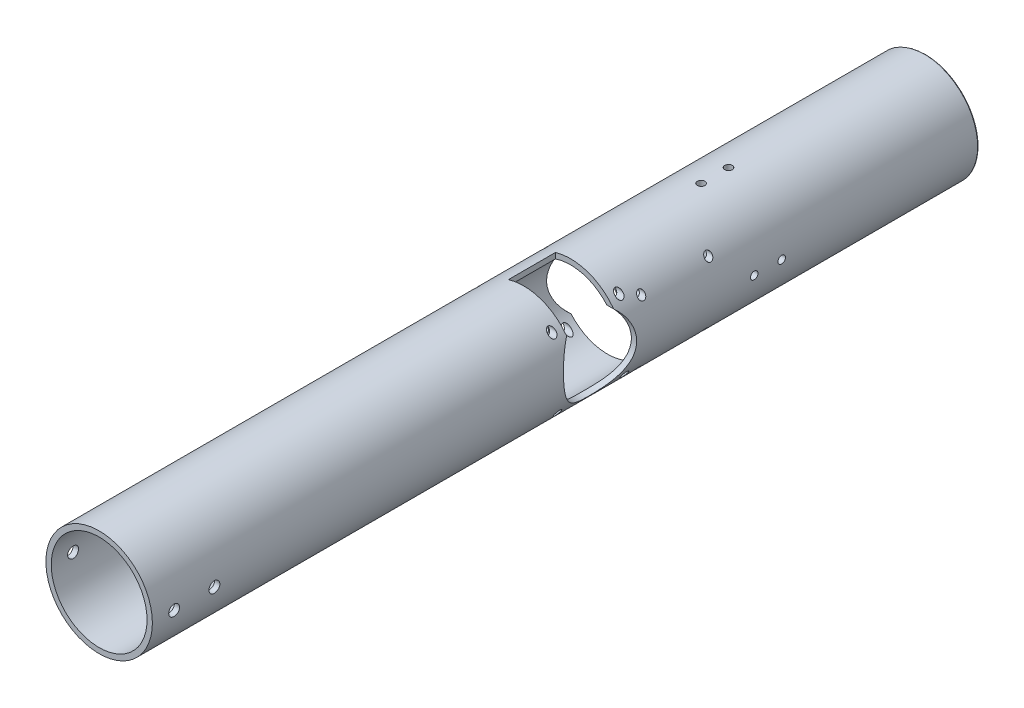
from build123d import *

# Parameters (mm, degrees)
BOSS_EXTRUDE1_DEPTH           = 125
BOSS_EXTRUDE1_DEPTH_BACK      = 250
SKETCH1_R                     = 31.75
SKETCH1_R_2                   = 28.575
SKETCH2_R                     = 21.75
CUT_EXTRUDE1_DEPTH            = 255.000246063
SKETCH3_R                     = 21.75
CUT_EXTRUDE2_DEPTH            = 255.000246187
CUT_EXTRUDE4_START            = 9
SKETCH5_W                     = 28
SKETCH5_H                     = 22
CUT_EXTRUDE4_DEPTH            = 264.000246187
CUT_EXTRUDE5_START            = -9
SKETCH6_W                     = 28
SKETCH6_H                     = 22
CUT_EXTRUDE5_DEPTH            = 264.000246187
CUT_EXTRUDE8_DEPTH            = 255.000246187
CUT_EXTRUDE8_DEPTH_BACK       = 255.000246187
SKETCH11_R                    = 2
CUT_EXTRUDE10_DEPTH           = 255.000246187
CUT_EXTRUDE10_DEPTH_BACK      = 255.000246187
SKETCH12_R                    = 3.25
CUT_EXTRUDE12_DEPTH           = 255.000246187
CUT_EXTRUDE12_DEPTH_BACK      = 255.000246187
SKETCH15_R                    = 2
SKETCH19_W                    = 2.25
SKETCH19_H                    = 31.75
M4_CLEARANCE_HOLE1_AT_2_COUNT = 2
M4_CLEARANCE_HOLE1_AT_2_PITCH = 40
M4_CLEARANCE_HOLE1_AT_3_COUNT = 2
M4_CLEARANCE_HOLE1_AT_3_PITCH = 40
M4_CLEARANCE_HOLE1_AT_4_COUNT = 2
M4_CLEARANCE_HOLE1_AT_4_PITCH = 56.568542495
M4_CLEARANCE_HOLE1_AT_5_COUNT = 2
M4_CLEARANCE_HOLE1_AT_5_PITCH = 90.126807577
M4_CLEARANCE_HOLE1_AT_6_COUNT = 2
M4_CLEARANCE_HOLE1_AT_6_PITCH = 50.197623888
M4_CLEARANCE_HOLE1_AT_7_COUNT = 2
M4_CLEARANCE_HOLE1_AT_7_PITCH = 100.213978286
M4_CLEARANCE_HOLE1_AT_8_COUNT = 2
M4_CLEARANCE_HOLE1_AT_8_PITCH = 66.631835064
MIRROR1_COPY_1_SKETCH_W       = 2.25
MIRROR1_COPY_1_SKETCH_H       = 31.75
MIRROR1_COPY_2_SKETCH_W       = 2.25
MIRROR1_COPY_2_SKETCH_H       = 31.75
MIRROR1_COPY_3_SKETCH_W       = 2.25
MIRROR1_COPY_3_SKETCH_H       = 31.75
MIRROR1_COPY_4_SKETCH_W       = 2.25
MIRROR1_COPY_4_SKETCH_H       = 31.75
MIRROR1_COPY_5_SKETCH_W       = 2.25
MIRROR1_COPY_5_SKETCH_H       = 31.75
MIRROR1_COPY_6_SKETCH_W       = 2.25
MIRROR1_COPY_6_SKETCH_H       = 31.75
MIRROR1_COPY_7_SKETCH_W       = 2.25
MIRROR1_COPY_7_SKETCH_H       = 31.75
SKETCH21_R                    = 30
CUT_EXTRUDE14_DEPTH           = 7
SKETCH22_R                    = 2.25
CUT_EXTRUDE15_DEPTH           = 255.000246187
CIRPATTERN2_COUNT             = 4
SKETCH23_R                    = 30
SKETCH23_R_2                  = 28.575
BOSS_EXTRUDE2_DEPTH           = 7
SKETCH24_R                    = 31.75
SKETCH24_R_2                  = 28.575
BOSS_EXTRUDE3_DEPTH           = 118.65
SKETCH25_R                    = 31.75
CUT_EXTRUDE16_DEPTH           = 1
FILLET1_R                     = 0.5


with BuildPart() as part:
    # Sketch1 → Boss-Extrude1 (new, two sides: drawn at the far end of the back side and taken through both)
    with BuildSketch(Plane.XY.offset(-BOSS_EXTRUDE1_DEPTH_BACK)):
        Circle(SKETCH1_R)
        Circle(SKETCH1_R_2, mode=Mode.SUBTRACT)
    extrude(amount=BOSS_EXTRUDE1_DEPTH + BOSS_EXTRUDE1_DEPTH_BACK)

    # Sketch2 → Cut-Extrude1 (cut, through all)
    with BuildSketch(Plane(origin=(0, 0, 0), x_dir=(0, 0, -1), z_dir=(1, 0, 0))):
        with Locations((73.488, -2)):
            Circle(SKETCH2_R)
    extrude(amount=-CUT_EXTRUDE1_DEPTH, mode=Mode.SUBTRACT)

    # Sketch3 → Cut-Extrude2 (cut, through all)
    with BuildSketch(Plane(origin=(0, 0, 0), x_dir=(0, 0, -1), z_dir=(1, 0, 0))):
        with Locations(Location((23.45, 2, 0), (0, 0, 354.723969399))):
            Circle(SKETCH3_R)
    extrude(amount=CUT_EXTRUDE2_DEPTH, mode=Mode.SUBTRACT)

    # Sketch5 → Cut-Extrude4 (cut, through all)
    with BuildSketch(Plane(origin=(0, 0, 0), x_dir=(0, 0, -1), z_dir=(1, 0, 0)).offset(CUT_EXTRUDE4_START)):
        with Locations((73.488, -23.75)):
            Rectangle(SKETCH5_W, SKETCH5_H)
    extrude(amount=-CUT_EXTRUDE4_DEPTH, mode=Mode.SUBTRACT)

    # Sketch6 → Cut-Extrude5 (cut, through all)
    with BuildSketch(Plane(origin=(0, 0, 0), x_dir=(0, 0, -1), z_dir=(1, 0, 0)).offset(CUT_EXTRUDE5_START)):
        with Locations((23.45, 23.75)):
            Rectangle(SKETCH6_W, SKETCH6_H)
    extrude(amount=CUT_EXTRUDE5_DEPTH, mode=Mode.SUBTRACT)

    # Sketch11 → Cut-Extrude8 (cut, two sides: drawn at the far end of the back side and taken through both)
    with BuildSketch(Plane(origin=(0, 0, 0), x_dir=(0, 0, -1), z_dir=(1, 0, 0)).offset(-CUT_EXTRUDE8_DEPTH_BACK)):
        with Locations((93.488, 18)):
            Circle(SKETCH11_R)
        with Locations((53.488, 18)):
            Circle(SKETCH11_R)
        with Locations((53.488, -22)):
            Circle(SKETCH11_R)
        with Locations((93.488, -22)):
            Circle(SKETCH11_R)
    extrude(amount=CUT_EXTRUDE8_DEPTH + CUT_EXTRUDE8_DEPTH_BACK, mode=Mode.SUBTRACT)

    # Sketch12 → Cut-Extrude10 (cut, two sides: drawn at the far end of the back side and taken through both)
    with BuildSketch(Plane(origin=(0, 0, 0), x_dir=(0, 0, -1), z_dir=(1, 0, 0)).offset(-CUT_EXTRUDE10_DEPTH_BACK)):
        with Locations((-112, 0)):
            Circle(SKETCH12_R)
        with Locations((-88, 0)):
            Circle(SKETCH12_R)
    extrude(amount=CUT_EXTRUDE10_DEPTH + CUT_EXTRUDE10_DEPTH_BACK, mode=Mode.SUBTRACT)

    # Sketch15 → Cut-Extrude12 (cut, two sides: drawn at the far end of the back side and taken through both)
    with BuildSketch(Plane(origin=(0, 0, 0), x_dir=(0, 0, -1), z_dir=(1, 0, 0)).offset(-CUT_EXTRUDE12_DEPTH_BACK)):
        with Locations((3.45, 22)):
            Circle(SKETCH15_R)
        with Locations((43.45, 22)):
            Circle(SKETCH15_R)
        with Locations((43.45, -18)):
            Circle(SKETCH15_R)
        with Locations((3.45, -18)):
            Circle(SKETCH15_R)
    extrude(amount=CUT_EXTRUDE12_DEPTH + CUT_EXTRUDE12_DEPTH_BACK, mode=Mode.SUBTRACT)

    # Sketch19 → M4 Clearance Hole1 (revolve, cut)
    with BuildSketch(Plane(origin=(0, 22, -3.45), x_dir=(0, 0, 1), z_dir=(0, 1, 0))):
        with Locations((1.125, 15.875)):
            Rectangle(SKETCH19_W, SKETCH19_H)
    m4_clearance_hole1 = revolve(axis=Axis((-6.35, 22, -3.45), (1, 0, 0)), mode=Mode.SUBTRACT)

    # M4 Clearance Hole1 at 2: M4 Clearance Hole1 ×2
    with Locations(*[(0, 0, -i * M4_CLEARANCE_HOLE1_AT_2_PITCH) for i in range(1, M4_CLEARANCE_HOLE1_AT_2_COUNT)]):
        add(m4_clearance_hole1, mode=Mode.SUBTRACT)

    # M4 Clearance Hole1 at 3: M4 Clearance Hole1 ×2
    with Locations(*[(0, -i * M4_CLEARANCE_HOLE1_AT_3_PITCH, 0) for i in range(1, M4_CLEARANCE_HOLE1_AT_3_COUNT)]):
        add(m4_clearance_hole1, mode=Mode.SUBTRACT)

    # M4 Clearance Hole1 at 4: M4 Clearance Hole1 ×2
    with Locations(*[Vector(0, -0.7071067811865478, -0.7071067811865472) * (i * M4_CLEARANCE_HOLE1_AT_4_PITCH) for i in range(1, M4_CLEARANCE_HOLE1_AT_4_COUNT)]):
        add(m4_clearance_hole1, mode=Mode.SUBTRACT)

    # M4 Clearance Hole1 at 5: M4 Clearance Hole1 ×2
    with Locations(*[Vector(0, -0.04438191152602306, -0.9990146374950151) * (i * M4_CLEARANCE_HOLE1_AT_5_PITCH) for i in range(1, M4_CLEARANCE_HOLE1_AT_5_COUNT)]):
        add(m4_clearance_hole1, mode=Mode.SUBTRACT)

    # M4 Clearance Hole1 at 6: M4 Clearance Hole1 ×2
    with Locations(*[Vector(0, -0.07968504662542611, -0.9968200907607669) * (i * M4_CLEARANCE_HOLE1_AT_6_PITCH) for i in range(1, M4_CLEARANCE_HOLE1_AT_6_COUNT)]):
        add(m4_clearance_hole1, mode=Mode.SUBTRACT)

    # M4 Clearance Hole1 at 7: M4 Clearance Hole1 ×2
    with Locations(*[Vector(0, -0.43906050585303297, -0.8984574960453493) * (i * M4_CLEARANCE_HOLE1_AT_7_PITCH) for i in range(1, M4_CLEARANCE_HOLE1_AT_7_COUNT)]):
        add(m4_clearance_hole1, mode=Mode.SUBTRACT)

    # M4 Clearance Hole1 at 8: M4 Clearance Hole1 ×2
    with Locations(*[Vector(0, -0.6603450131265124, -0.7509623583369185) * (i * M4_CLEARANCE_HOLE1_AT_8_PITCH) for i in range(1, M4_CLEARANCE_HOLE1_AT_8_COUNT)]):
        add(m4_clearance_hole1, mode=Mode.SUBTRACT)

    # Mirror1: M4 Clearance Hole1 across plane
    add(m4_clearance_hole1.mirror(Plane(origin=(0, 0, 0), x_dir=(0, 0, 1), z_dir=(1, 0, 0))), mode=Mode.SUBTRACT)

    # Mirror1 copy 1 sketch → Mirror1 copy 1 (revolve, cut)
    with BuildSketch(Plane(origin=(0, 22, -43.45), x_dir=(0, 0, 1), z_dir=(0, 1, 0))):
        with Locations((1.125, -15.875)):
            Rectangle(MIRROR1_COPY_1_SKETCH_W, MIRROR1_COPY_1_SKETCH_H)
    revolve(axis=Axis((6.35, 22, -43.45), (1, 0, 0)), mode=Mode.SUBTRACT)

    # Mirror1 copy 2 sketch → Mirror1 copy 2 (revolve, cut)
    with BuildSketch(Plane(origin=(0, -18, -3.45), x_dir=(0, 0, 1), z_dir=(0, 1, 0))):
        with Locations((1.125, -15.875)):
            Rectangle(MIRROR1_COPY_2_SKETCH_W, MIRROR1_COPY_2_SKETCH_H)
    revolve(axis=Axis((6.35, -18, -3.45), (1, 0, 0)), mode=Mode.SUBTRACT)

    # Mirror1 copy 3 sketch → Mirror1 copy 3 (revolve, cut)
    with BuildSketch(Plane(origin=(0, -18, -43.45), x_dir=(0, 0, 1), z_dir=(0, 1, 0))):
        with Locations((1.125, -15.875)):
            Rectangle(MIRROR1_COPY_3_SKETCH_W, MIRROR1_COPY_3_SKETCH_H)
    revolve(axis=Axis((6.35, -18, -43.45), (1, 0, 0)), mode=Mode.SUBTRACT)

    # Mirror1 copy 4 sketch → Mirror1 copy 4 (revolve, cut)
    with BuildSketch(Plane(origin=(0, 18, -93.488), x_dir=(0, 0, 1), z_dir=(0, 1, 0))):
        with Locations((1.125, -15.875)):
            Rectangle(MIRROR1_COPY_4_SKETCH_W, MIRROR1_COPY_4_SKETCH_H)
    revolve(axis=Axis((6.35, 18, -93.488), (1, 0, 0)), mode=Mode.SUBTRACT)

    # Mirror1 copy 5 sketch → Mirror1 copy 5 (revolve, cut)
    with BuildSketch(Plane(origin=(0, 18, -53.488), x_dir=(0, 0, 1), z_dir=(0, 1, 0))):
        with Locations((1.125, -15.875)):
            Rectangle(MIRROR1_COPY_5_SKETCH_W, MIRROR1_COPY_5_SKETCH_H)
    revolve(axis=Axis((6.35, 18, -53.488), (1, 0, 0)), mode=Mode.SUBTRACT)

    # Mirror1 copy 6 sketch → Mirror1 copy 6 (revolve, cut)
    with BuildSketch(Plane(origin=(0, -22, -93.488), x_dir=(0, 0, 1), z_dir=(0, 1, 0))):
        with Locations((1.125, -15.875)):
            Rectangle(MIRROR1_COPY_6_SKETCH_W, MIRROR1_COPY_6_SKETCH_H)
    revolve(axis=Axis((6.35, -22, -93.488), (1, 0, 0)), mode=Mode.SUBTRACT)

    # Mirror1 copy 7 sketch → Mirror1 copy 7 (revolve, cut)
    with BuildSketch(Plane(origin=(0, -22, -53.488), x_dir=(0, 0, 1), z_dir=(0, 1, 0))):
        with Locations((1.125, -15.875)):
            Rectangle(MIRROR1_COPY_7_SKETCH_W, MIRROR1_COPY_7_SKETCH_H)
    revolve(axis=Axis((6.35, -22, -53.488), (1, 0, 0)), mode=Mode.SUBTRACT)

    # Sketch21 → Cut-Extrude14 (cut)
    with BuildSketch(Plane(origin=(0, 0, -250), x_dir=(-1, 0, 0), z_dir=(0, 0, -1))):
        Circle(SKETCH21_R)
    extrude(amount=-CUT_EXTRUDE14_DEPTH, mode=Mode.SUBTRACT)

    # Sketch22 → Cut-Extrude15 (cut, through all)
    with BuildSketch(Plane(origin=(0, 0, 0), x_dir=(0, 0, -1), z_dir=(1, 0, 0))):
        with Locations(Location((131.65, 0, 0), (0, 0, 180))):
            Circle(SKETCH22_R)
        with Locations(Location((115.3, 0, 0), (0, 0, 180))):
            Circle(SKETCH22_R)
    cut_extrude15 = extrude(amount=CUT_EXTRUDE15_DEPTH, mode=Mode.SUBTRACT)

    # CirPattern2: Cut-Extrude15 ×4 about axis
    cirpattern2_axis = Axis((0, 0, -250), (0, 0, 1))
    for i in range(1, CIRPATTERN2_COUNT):
        add(cut_extrude15.rotate(cirpattern2_axis, i * 360 / CIRPATTERN2_COUNT), mode=Mode.SUBTRACT)

    # Sketch23 → Boss-Extrude2 (add)
    with BuildSketch(Plane(origin=(0, 0, -243), x_dir=(-1, 0, 0), z_dir=(0, 0, -1))):
        Circle(SKETCH23_R)
        with Locations(Location((0, 0, 0), (0, 0, 180))):
            Circle(SKETCH23_R_2, mode=Mode.SUBTRACT)
    extrude(amount=BOSS_EXTRUDE2_DEPTH)


with BuildPart() as body_2:
    # Split1: the piece on the far side of the plane
    add(part.part)
    split(bisect_by=Plane.XY.offset(75), keep=Keep.BOTTOM)


with BuildPart() as part_1:
    add(part.part)

    # Split1
    split(bisect_by=Plane.XY.offset(75), keep=Keep.TOP)


with BuildPart() as part_2:
    # Body-Move/Copy1: moved
    add(part_1.part.moved(Location((0, 0, 118.65))))


    add(body_2.part)  # Boss-Extrude3 merges body 2
    # Sketch24 → Boss-Extrude3 (add)
    with BuildSketch(Plane.XY.offset(75)):
        Circle(SKETCH24_R)
        Circle(SKETCH24_R_2, mode=Mode.SUBTRACT)
    extrude(amount=BOSS_EXTRUDE3_DEPTH)

    # Sketch25 → Cut-Extrude16 (cut)
    with BuildSketch(Plane(origin=(0, 0, -250), x_dir=(-1, 0, 0), z_dir=(0, 0, -1))):
        with Locations(Location((0, 0, 0), (0, 0, 180))):
            Circle(SKETCH25_R)
    extrude(amount=-CUT_EXTRUDE16_DEPTH, mode=Mode.SUBTRACT)

    # Fillet1
    fillet1_edges = [part_2.edges().sort_by_distance(p)[0] for p in [
        (-31.75, 0, -249),
        (-28.575, 0, -249),
    ]]
    fillet(fillet1_edges, radius=FILLET1_R)


solid = part_2.part
